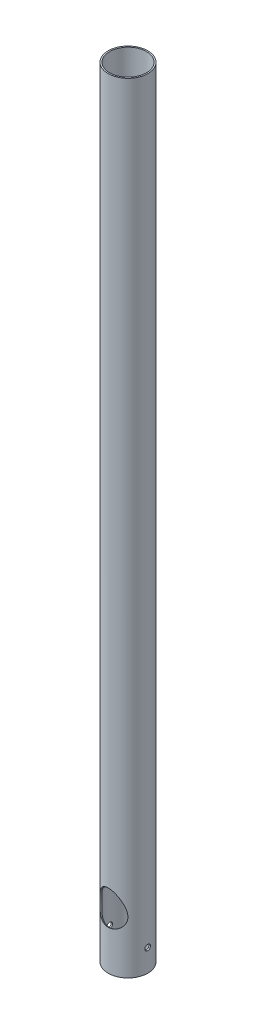
from build123d import *

# Parameters (mm, degrees)
EXTRUDE_1_OUTLINE_R      = 71
EXTRUDE_1_OUTLINE_R_2    = 66
EXTRUDE_1_DEPTH          = 2790
CUT_EXTRUDE_3_DEPTH      = 2792.806225367
CUT_EXTRUDE_3_DEPTH_BACK = 2792.806225367
SKETCH_6_R               = 10
SKETCH_7_R               = 50
CUT_EXTRUDE_4_DEPTH      = 200
SKETCH_13_R              = 52.5
CUT_EXTRUDE_8_DEPTH      = 200


# Read off the part's stored shape, not the designer's step: Вытянуть-Тонкостенный1
with BuildPart() as part:
    # Вытянуть-Тонкостенный1 outline → Вытянуть-Тонкостенный1 (new body)
    with BuildSketch(Plane(origin=(0, 0, 0), x_dir=(1, 0, 0), z_dir=(0, 1, 0))):
        Circle(EXTRUDE_1_OUTLINE_R)
        Circle(EXTRUDE_1_OUTLINE_R_2, mode=Mode.SUBTRACT)
    extrude(amount=EXTRUDE_1_DEPTH)

    # Эскиз6 → Вырез-Вытянуть3 (cut, two sides: drawn at the far end of the back side and taken through both)
    with BuildSketch(Plane(origin=(0, 0, 0), x_dir=(0, 0, -1), z_dir=(1, 0, 0)).offset(-CUT_EXTRUDE_3_DEPTH_BACK)):
        with Locations((0, 80)):
            Circle(SKETCH_6_R)
    extrude(amount=CUT_EXTRUDE_3_DEPTH + CUT_EXTRUDE_3_DEPTH_BACK, mode=Mode.SUBTRACT)

    # Эскиз7 → Вырез-Вытянуть4 (cut)
    with BuildSketch(Plane(origin=(0, 176.689515805, 252.338779809), x_dir=(1, 0, 0), z_dir=(0, -0.5735764363510416, -0.8191520442889949))):
        with Locations(Location((0, -126.118813858, 0), (0, 0, 90))):
            Circle(SKETCH_7_R)
    extrude(amount=CUT_EXTRUDE_4_DEPTH, mode=Mode.SUBTRACT)

    # Эскиз13 → Вырез-Вытянуть8 (cut)
    with BuildSketch(Plane(origin=(0, 750.265952156, 1071.490824098), x_dir=(1, 0, 0), z_dir=(0, -0.5735764363510416, -0.8191520442889949))):
        with Locations(Location((0, -2185, 0), (0, 0, 270))):
            Circle(SKETCH_13_R)
    extrude(amount=-CUT_EXTRUDE_8_DEPTH, mode=Mode.SUBTRACT)


solid = part.part
